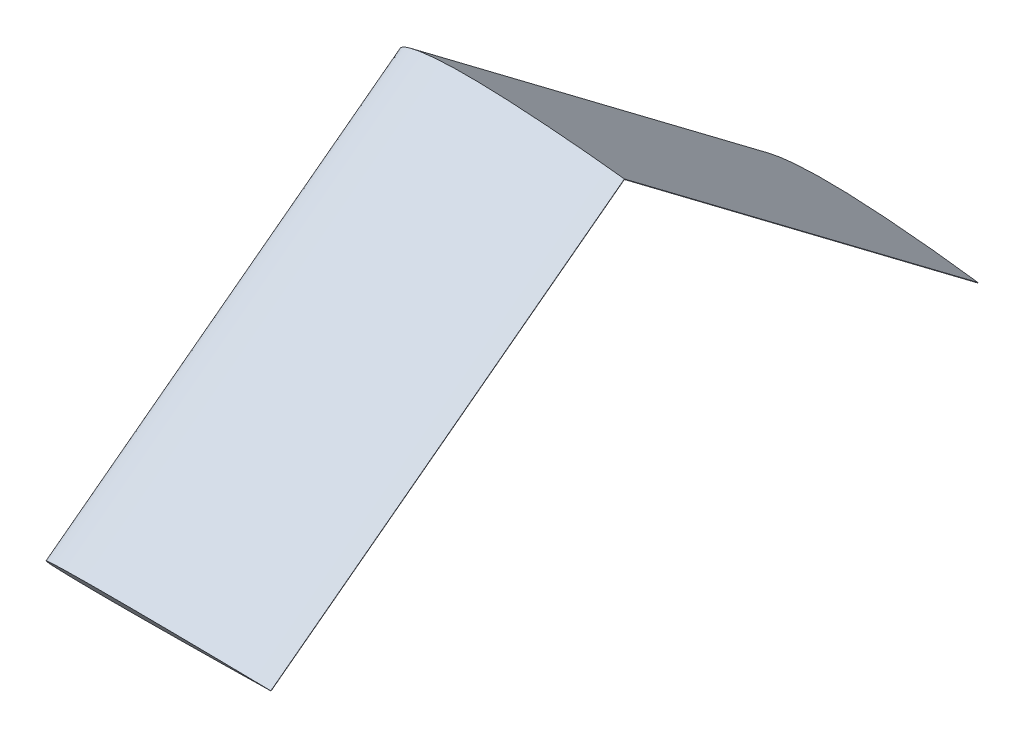
from build123d import *

# Parameters (mm, degrees)
BOSS_EXTRUDE1_DEPTH = 400
CUT_EXTRUDE1_DEPTH  = 200


# Read off the part's stored shape, not the designer's step: Mirror4
with BuildPart() as part:
    # Sketch3 → Boss-Extrude1 (new body)
    with BuildSketch(Plane(origin=(0, 0, 0), x_dir=(1, 0, 0), z_dir=(0, -0.6018150231520495, 0.798635510047292))):
        with BuildLine():
            Line((143.952602362, 98.765851684), (143.952602362, 98.429851684))
            add(Edge.make_bspline(
                [(143.952602362, 98.765851684), (140.619579992, 99.071344644), (133.954991813, 99.682197061), (120.623721605, 100.819649644), (103.959189075, 102.125073674), (83.958600229, 103.513575069), (63.958811613, 104.721347131), (43.958619563, 105.702130107), (23.957799478, 106.403744671), (3.951945597, 106.697302216), (-12.721734949, 106.455819807), (-26.060671375, 105.782825601), (-34.393029508, 105.073154842), (-41.069288862, 104.225894417), (-46.060208337, 103.405197802), (-50.348144958, 102.333702672), (-53.716570632, 101.239826188), (-57.376625206, 98.597851684), (-53.716570632, 95.95587718), (-50.348144958, 94.862000695), (-46.060208337, 93.790505565), (-41.069288862, 92.96980895), (-34.393029508, 92.122548526), (-26.060671375, 91.412877767), (-12.721734949, 90.739883561), (3.951945597, 90.498401152), (23.957799478, 90.791958696), (43.958619563, 91.49357326), (63.958811613, 92.474356237), (83.958600229, 93.682128299), (103.959189075, 95.070629693), (120.623721605, 96.376053724), (133.954991813, 97.513506307), (140.619579992, 98.124358724), (143.952602362, 98.429851684)],
                knots=[0, 0, 0, 0, 0.024876293, 0.049741715, 0.099443402, 0.149112224, 0.198750974, 0.248359097, 0.29793737, 0.347491327, 0.397050924, 0.421859475, 0.446731346, 0.459220451, 0.471790602, 0.484560454, 0.491195112, 0.5, 0.508804888, 0.515439546, 0.528209398, 0.540779549, 0.553268654, 0.578140525, 0.602949076, 0.652508673, 0.70206263, 0.751640903, 0.801249026, 0.850887776, 0.900556598, 0.950258285, 0.975123707, 1, 1, 1, 1], degree=3))
        make_face()
    extrude(amount=BOSS_EXTRUDE1_DEPTH)

    # Sketch4 → Cut-Extrude1 (cut, symmetric)
    with BuildSketch(Plane(origin=(0, 0, 0), x_dir=(0, 0, -1), z_dir=(1, 0, 0))):
        Polygon((-64.153542486, 85.134626345), (-64.153542486, 78.456106511), (-64.153542486, 62.686376951), (-40.490954752, 62.686376951), (-40.490954752, 96.268025792), (-64.153542486, 96.268025792), align=None)
    extrude(amount=CUT_EXTRUDE1_DEPTH, both=True, mode=Mode.SUBTRACT)

    # Mirror4: part across plane


with BuildPart() as part_1:
    add(part.part)
    add(part.part.mirror(Plane(origin=(-200, 78.456106511, 64.153542486), x_dir=(1, 0, 0), z_dir=(0, 0, 1))))


solid = part_1.part
